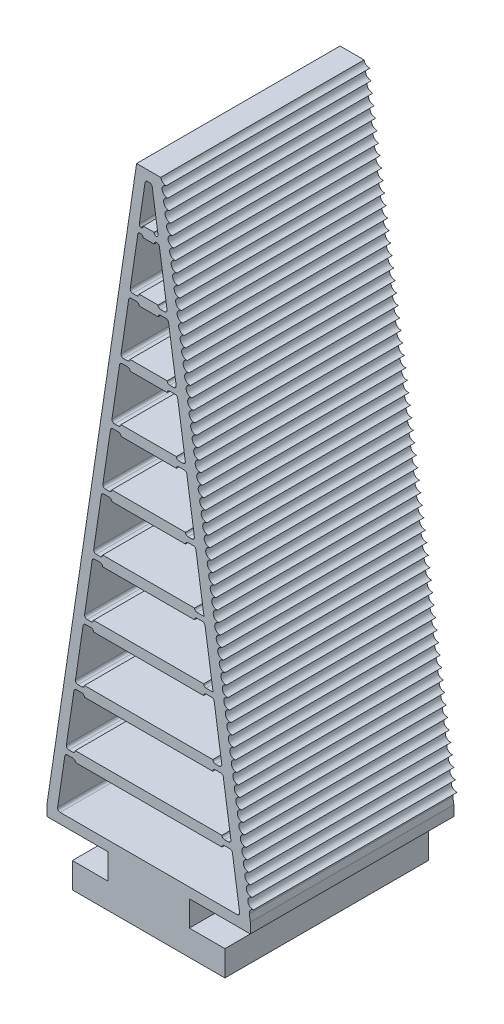
from build123d import *

# Parameters (mm, degrees)
BOSS_EXTRUDE1_DEPTH = 40
CUT_EXTRUDE1_DEPTH  = 138.477270849
CUT_EXTRUDE2_DEPTH  = 138.477270849
CUT_EXTRUDE3_DEPTH  = 138.477270849
CUT_EXTRUDE4_DEPTH  = 138.477270849
CUT_EXTRUDE5_DEPTH  = 138.477270849
CUT_EXTRUDE6_DEPTH  = 138.477270849
CUT_EXTRUDE7_DEPTH  = 138.477270849
CUT_EXTRUDE8_DEPTH  = 138.477270849
CUT_EXTRUDE9_DEPTH  = 138.477270849
CUT_EXTRUDE10_DEPTH = 138.477270849
FILLET1_R           = 0.5
BOSS_EXTRUDE2_DEPTH = 40
FILLET2_R           = 0.5


# Some blends are built 0.0001 mm under size
with BuildPart() as part:
    # Sketch1 → Boss-Extrude1 (new body)
    with BuildSketch(Plane.XY):
        Polygon((-15, 0), (15, 0), (15, 5), (8, 5), (8, 10), (20, 10), (20, 12), (2.364781841, 130), (-2.364781841, 130), (-20, 12), (-20, 10), (-8, 10), (-8, 5), (-15, 5), align=None)
    extrude(amount=BOSS_EXTRUDE1_DEPTH)

    # Sketch2 → Cut-Extrude1 (cut, through all)
    with BuildSketch(Plane.XY.offset(40)):
        Polygon((-17.977787744, 12), (17.977787744, 12), (16.40855223, 22.5), (14.40855223, 22.5), (14.40855223, 22), (-14.40855223, 22), (-14.40855223, 22.5), (-16.40855223, 22.5), align=None)
    extrude(amount=-CUT_EXTRUDE1_DEPTH, mode=Mode.SUBTRACT)

    # Sketch3 → Cut-Extrude2 (cut, through all)
    with BuildSketch(Plane.XY.offset(40)):
        Polygon((-16.259101229, 23.5), (-14.40855223, 23.5), (-14.40855223, 24), (14.40855223, 24), (14.40855223, 23.5), (16.259101229, 23.5), (14.615140214, 34.5), (12.615140214, 34.5), (12.615140214, 34), (-12.615140214, 34), (-12.615140214, 34.5), (-14.615140214, 34.5), align=None)
    extrude(amount=-CUT_EXTRUDE2_DEPTH, mode=Mode.SUBTRACT)

    # Sketch4 → Cut-Extrude3 (cut, through all)
    with BuildSketch(Plane.XY.offset(40)):
        Polygon((-14.465689213, 35.5), (-12.615140214, 35.5), (-12.615140214, 36), (12.615140214, 36), (12.615140214, 35.5), (14.465689213, 35.5), (12.821728198, 46.5), (10.821728198, 46.5), (10.821728198, 46), (-10.821728198, 46), (-10.821728198, 46.5), (-12.821728198, 46.5), align=None)
    extrude(amount=-CUT_EXTRUDE3_DEPTH, mode=Mode.SUBTRACT)

    # Sketch5 → Cut-Extrude4 (cut, through all)
    with BuildSketch(Plane.XY.offset(40)):
        Polygon((-12.672277196, 47.5), (-10.821728198, 47.5), (-10.821728198, 48), (10.821728198, 48), (10.821728198, 47.5), (12.672277196, 47.5), (11.028316182, 58.5), (9.028316182, 58.5), (9.028316182, 58), (-9.028316182, 58), (-9.028316182, 58.5), (-11.028316182, 58.5), align=None)
    extrude(amount=-CUT_EXTRUDE4_DEPTH, mode=Mode.SUBTRACT)

    # Sketch6 → Cut-Extrude5 (cut, through all)
    with BuildSketch(Plane.XY.offset(40)):
        Polygon((-10.87886518, 59.5), (-9.028316182, 59.5), (-9.028316182, 60), (9.028316182, 60), (9.028316182, 59.5), (10.87886518, 59.5), (9.234904165, 70.5), (7.234904165, 70.5), (7.234904165, 70), (-7.234904165, 70), (-7.234904165, 70.5), (-9.234904165, 70.5), align=None)
    extrude(amount=-CUT_EXTRUDE5_DEPTH, mode=Mode.SUBTRACT)

    # Sketch7 → Cut-Extrude6 (cut, through all)
    with BuildSketch(Plane.XY.offset(40)):
        Polygon((-9.085453164, 71.5), (-7.234904165, 71.5), (-7.234904165, 72), (7.234904165, 72), (7.234904165, 71.5), (9.085453164, 71.5), (7.441492149, 82.5), (5.441492149, 82.5), (5.441492149, 82), (-5.441492149, 82), (-5.441492149, 82.5), (-7.441492149, 82.5), align=None)
    extrude(amount=-CUT_EXTRUDE6_DEPTH, mode=Mode.SUBTRACT)

    # Sketch8 → Cut-Extrude7 (cut, through all)
    with BuildSketch(Plane.XY.offset(40)):
        Polygon((-7.292041148, 83.5), (-5.441492149, 83.5), (-5.441492149, 84), (5.441492149, 84), (5.441492149, 83.5), (7.292041148, 83.5), (5.648080133, 94.5), (3.648080133, 94.5), (3.648080133, 94), (-3.648080133, 94), (-3.648080133, 94.5), (-5.648080133, 94.5), align=None)
    extrude(amount=-CUT_EXTRUDE7_DEPTH, mode=Mode.SUBTRACT)

    # Sketch10 → Cut-Extrude8 (cut, through all)
    with BuildSketch(Plane.XY.offset(40)):
        Polygon((-5.498629132, 95.5), (-3.648080133, 95.5), (-3.648080133, 96), (3.648080133, 96), (3.648080133, 95.5), (5.498629132, 95.5), (3.854668117, 106.5), (1.854668117, 106.5), (1.854668117, 106), (-1.854668117, 106), (-1.854668117, 106.5), (-3.854668117, 106.5), align=None)
    extrude(amount=-CUT_EXTRUDE8_DEPTH, mode=Mode.SUBTRACT)

    # Sketch11 → Cut-Extrude9 (cut, through all)
    with BuildSketch(Plane.XY.offset(40)):
        Polygon((-3.705217115, 107.5), (-1.854668117, 107.5), (-1.854668117, 108), (1.854668117, 108), (1.854668117, 107.5), (3.705217115, 107.5), (2.061256101, 118.5), (1.061256101, 118.5), (1.061256101, 118), (-1.061256101, 118), (-1.061256101, 118.5), (-2.061256101, 118.5), align=None)
    extrude(amount=-CUT_EXTRUDE9_DEPTH, mode=Mode.SUBTRACT)

    # Sketch12 → Cut-Extrude10 (cut, through all)
    with BuildSketch(Plane.XY.offset(40)):
        Polygon((-1.911805099, 119.5), (-1.061256101, 119.5), (-1.061256101, 120), (1.061256101, 120), (1.061256101, 119.5), (1.911805099, 119.5), (0.641471588, 128), (-0.641471588, 128), align=None)
    extrude(amount=-CUT_EXTRUDE10_DEPTH, mode=Mode.SUBTRACT)

    # Fillet1
    fillet1_edges = [part.edges().sort_by_distance(p)[0] for p in [
        (-1.061256101, 119.5, 20),
        (-1.854668117, 107.5, 20),
        (-1.061256101, 118.5, 20),
        (-1.854668117, 106.5, 20),
        (1.061256101, 119.5, 20),
        (1.061256101, 118.5, 20),
        (1.854668117, 106.5, 20),
        (3.648080133, 94.5, 20),
        (-3.648080133, 94.5, 20),
        (-5.441492149, 82.5, 20),
        (-3.648080133, 95.5, 20),
        (-5.441492149, 83.5, 20),
        (-7.234904165, 71.5, 20),
        (-9.028316182, 59.5, 20),
        (1.854668117, 107.5, 20),
        (3.648080133, 95.5, 20),
        (5.441492149, 83.5, 20),
        (7.234904165, 71.5, 20),
        (9.028316182, 59.5, 20),
        (10.821728198, 47.5, 20),
        (5.441492149, 82.5, 20),
        (7.234904165, 70.5, 20),
        (9.028316182, 58.5, 20),
        (10.821728198, 46.5, 20),
        (-7.234904165, 70.5, 20),
        (-9.028316182, 58.5, 20),
        (-10.821728198, 46.5, 20),
        (-10.821728198, 47.5, 20),
        (-12.615140214, 35.5, 20),
        (12.615140214, 35.5, 20),
        (12.615140214, 34.5, 20),
        (-12.615140214, 34.5, 20),
        (-14.40855223, 22.5, 20),
        (-14.40855223, 23.5, 20),
        (14.40855223, 22.5, 20),
        (14.40855223, 23.5, 20),
    ]]
    fillet(fillet1_edges, radius=FILLET1_R - 0.0001)  # a hair under: the kernel refuses the full size

    # Sketch13 → Boss-Extrude2 (add)
    with BuildSketch(Plane.XY.offset(40)):
        with BuildLine():
            Line((2.364781841, 130), (0.342569585, 130))
            Line((0.342569585, 130), (17.828260627, 13.000509301))
            Line((17.828260627, 13.000509301), (19.806292354, 13.296128123))
            ThreePointArc((19.806292354, 13.296128123), (19.991451357, 14.038760321), (20.647498806, 14.432953398))
            ThreePointArc((20.647498806, 14.432953398), (19.510673532, 15.27415985), (20.351879984, 16.410985125))
            ThreePointArc((20.351879984, 16.410985125), (19.21505471, 17.252191577), (20.056261162, 18.389016851))
            ThreePointArc((20.056261162, 18.389016851), (18.919435887, 19.230223303), (19.76064234, 20.367048578))
            ThreePointArc((19.76064234, 20.367048578), (18.623817065, 21.20825503), (19.465023517, 22.345080305))
            ThreePointArc((19.465023517, 22.345080305), (18.328198243, 23.186286757), (19.169404695, 24.323112031))
            ThreePointArc((19.169404695, 24.323112031), (18.032579421, 25.164318484), (18.873785873, 26.301143758))
            ThreePointArc((18.873785873, 26.301143758), (17.736960598, 27.14235021), (18.578167051, 28.279175485))
            ThreePointArc((18.578167051, 28.279175485), (17.441341776, 29.120381937), (18.282548228, 30.257207212))
            ThreePointArc((18.282548228, 30.257207212), (17.145722954, 31.098413664), (17.986929406, 32.235238938))
            ThreePointArc((17.986929406, 32.235238938), (16.850104132, 33.076445391), (17.691310584, 34.213270665))
            ThreePointArc((17.691310584, 34.213270665), (16.554485309, 35.054477117), (17.395691761, 36.191302392))
            ThreePointArc((17.395691761, 36.191302392), (16.258866487, 37.032508844), (17.100072939, 38.169334118))
            ThreePointArc((17.100072939, 38.169334118), (15.963247665, 39.010540571), (16.804454117, 40.147365845))
            ThreePointArc((16.804454117, 40.147365845), (15.667628842, 40.988572297), (16.508835295, 42.125397572))
            ThreePointArc((16.508835295, 42.125397572), (15.37201002, 42.966604024), (16.213216472, 44.103429299))
            ThreePointArc((16.213216472, 44.103429299), (15.076391198, 44.944635751), (15.91759765, 46.081461025))
            ThreePointArc((15.91759765, 46.081461025), (14.780772376, 46.922667478), (15.621978828, 48.059492752))
            ThreePointArc((15.621978828, 48.059492752), (14.485153553, 48.900699204), (15.326360006, 50.037524479))
            ThreePointArc((15.326360006, 50.037524479), (14.189534731, 50.878730931), (15.030741183, 52.015556206))
            ThreePointArc((15.030741183, 52.015556206), (13.893915909, 52.856762658), (14.735122361, 53.993587932))
            ThreePointArc((14.735122361, 53.993587932), (13.598297087, 54.834794384), (14.439503539, 55.971619659))
            ThreePointArc((14.439503539, 55.971619659), (13.302678264, 56.812826111), (14.143884717, 57.949651386))
            ThreePointArc((14.143884717, 57.949651386), (13.007059442, 58.790857838), (13.848265894, 59.927683112))
            ThreePointArc((13.848265894, 59.927683112), (12.71144062, 60.768889565), (13.552647072, 61.905714839))
            ThreePointArc((13.552647072, 61.905714839), (12.415821798, 62.746921291), (13.25702825, 63.883746566))
            ThreePointArc((13.25702825, 63.883746566), (12.120202975, 64.724953018), (12.961409428, 65.861778293))
            ThreePointArc((12.961409428, 65.861778293), (11.824584153, 66.702984745), (12.665790605, 67.839810019))
            ThreePointArc((12.665790605, 67.839810019), (11.528965331, 68.681016472), (12.370171783, 69.817841746))
            ThreePointArc((12.370171783, 69.817841746), (11.233346509, 70.659048198), (12.074552961, 71.795873473))
            ThreePointArc((12.074552961, 71.795873473), (10.937727686, 72.637079925), (11.778934139, 73.7739052))
            ThreePointArc((11.778934139, 73.7739052), (10.642108864, 74.615111652), (11.483315316, 75.751936926))
            ThreePointArc((11.483315316, 75.751936926), (10.346490042, 76.593143378), (11.187696494, 77.729968653))
            ThreePointArc((11.187696494, 77.729968653), (10.05087122, 78.571175105), (10.892077672, 79.70800038))
            ThreePointArc((10.892077672, 79.70800038), (9.755252397, 80.549206832), (10.59645885, 81.686032106))
            ThreePointArc((10.59645885, 81.686032106), (9.459633575, 82.527238559), (10.300840027, 83.664063833))
            ThreePointArc((10.300840027, 83.664063833), (9.164014753, 84.505270285), (10.005221205, 85.64209556))
            ThreePointArc((10.005221205, 85.64209556), (8.868395931, 86.483302012), (9.709602383, 87.620127287))
            ThreePointArc((9.709602383, 87.620127287), (8.572777108, 88.461333739), (9.41398356, 89.598159013))
            ThreePointArc((9.41398356, 89.598159013), (8.277158286, 90.439365466), (9.118364738, 91.57619074))
            ThreePointArc((9.118364738, 91.57619074), (7.981539464, 92.417397192), (8.822745916, 93.554222467))
            ThreePointArc((8.822745916, 93.554222467), (7.685920641, 94.395428919), (8.527127094, 95.532254193))
            ThreePointArc((8.527127094, 95.532254193), (7.390301819, 96.373460646), (8.231508271, 97.51028592))
            ThreePointArc((8.231508271, 97.51028592), (7.094682997, 98.351492372), (7.935889449, 99.488317647))
            ThreePointArc((7.935889449, 99.488317647), (6.799064175, 100.329524099), (7.640270627, 101.466349374))
            ThreePointArc((7.640270627, 101.466349374), (6.503445352, 102.307555826), (7.344651805, 103.4443811))
            ThreePointArc((7.344651805, 103.4443811), (6.20782653, 104.285587553), (7.049032982, 105.422412827))
            ThreePointArc((7.049032982, 105.422412827), (5.912207708, 106.263619279), (6.75341416, 107.400444554))
            ThreePointArc((6.75341416, 107.400444554), (5.616588886, 108.241651006), (6.457795338, 109.378476281))
            ThreePointArc((6.457795338, 109.378476281), (5.320970063, 110.219682733), (6.162176516, 111.356508007))
            ThreePointArc((6.162176516, 111.356508007), (5.025351241, 112.197714459), (5.866557693, 113.334539734))
            ThreePointArc((5.866557693, 113.334539734), (4.729732419, 114.175746186), (5.570938871, 115.312571461))
            ThreePointArc((5.570938871, 115.312571461), (4.434113597, 116.153777913), (5.275320049, 117.290603187))
            ThreePointArc((5.275320049, 117.290603187), (4.138494774, 118.13180964), (4.979701227, 119.268634914))
            ThreePointArc((4.979701227, 119.268634914), (3.842875952, 120.109841366), (4.684082404, 121.246666641))
            ThreePointArc((4.684082404, 121.246666641), (3.54725713, 122.087873093), (4.388463582, 123.224698368))
            ThreePointArc((4.388463582, 123.224698368), (3.251638308, 124.06590482), (4.09284476, 125.202730094))
            ThreePointArc((4.09284476, 125.202730094), (2.956019485, 126.043936547), (3.797225938, 127.180761821))
            ThreePointArc((3.797225938, 127.180761821), (2.660400663, 128.021968273), (3.501607115, 129.158793548))
            ThreePointArc((3.501607115, 129.158793548), (2.758974917, 129.343952551), (2.364781841, 130))
        make_face()
    extrude(amount=-BOSS_EXTRUDE2_DEPTH)

    # Fillet2
    # the kernel refuses this fillet: 0.5 mm, written as the material it adds along each edge
    with BuildSketch(Plane(origin=(17.977787744, 12, 40), x_dir=(-1, 0, 0), z_dir=(0, 0, -1)), Plane(origin=(-17.977787744, 12, 40), x_dir=(0.14780941112960694, 0.9890158633619174, 0), z_dir=(0, 0, -1)), Plane(origin=(-3.705217115, 107.5, 40), x_dir=(0.14780941112960738, 0.9890158633619174, 0), z_dir=(0, 0, -1)), Plane(origin=(3.705217115, 107.5, 40), x_dir=(-1, 0, 0), z_dir=(0, 0, -1)), Plane(origin=(5.498629132, 95.5, 40), x_dir=(-1, 0, 0), z_dir=(0, 0, -1)), Plane(origin=(-5.498629132, 95.5, 40), x_dir=(0.14780941112960647, 0.9890158633619175, 0), z_dir=(0, 0, -1)), Plane(origin=(7.292041148, 83.5, 40), x_dir=(-1, 0, 0), z_dir=(0, 0, -1)), Plane(origin=(9.085453164, 71.5, 40), x_dir=(-1, 0, 0), z_dir=(0, 0, -1)), Plane(origin=(-7.292041148, 83.5, 40), x_dir=(0.14780941112960588, 0.9890158633619176, 0), z_dir=(0, 0, -1)), Plane(origin=(-9.085453164, 71.5, 40), x_dir=(0.14780941112960796, 0.9890158633619173, 0), z_dir=(0, 0, -1)), Plane(origin=(-10.87886518, 59.5, 40), x_dir=(0.14780941112960858, 0.9890158633619172, 0), z_dir=(0, 0, -1)), Plane(origin=(-12.672277196, 47.5, 40), x_dir=(0.14780941112960738, 0.9890158633619174, 0), z_dir=(0, 0, -1)), Plane(origin=(14.465689213, 35.5, 40), x_dir=(-1, 0, 0), z_dir=(0, 0, -1)), Plane(origin=(-14.465689213, 35.5, 40), x_dir=(0.14780941112960858, 0.9890158633619172, 0), z_dir=(0, 0, -1)), Plane(origin=(-16.259101229, 23.5, 40), x_dir=(0.1478094111296065, 0.9890158633619175, 0), z_dir=(0, 0, -1)), Plane(origin=(16.259101229, 23.5, 40), x_dir=(-1, 0, 0), z_dir=(0, 0, -1))) as fillet2_piece_1:
        with BuildLine():
            CenterArc((FILLET2_R * 1.16055712921, FILLET2_R), FILLET2_R, 171.5, 98.5)
            Line((FILLET2_R * 0.171541265851, FILLET2_R * 1.14780941113), (FILLET2_R * 0.151760948584, FILLET2_R * 1.15076559935))
            Line((FILLET2_R * 0.151760948584, FILLET2_R * 1.15076559935), (-FILLET2_R * 0.0232111425843, -FILLET2_R * 0.02))
            Line((-FILLET2_R * 0.0232111425843, -FILLET2_R * 0.02), (FILLET2_R * 1.16055712921, -FILLET2_R * 0.02))
            Line((FILLET2_R * 1.16055712921, -FILLET2_R * 0.02), (FILLET2_R * 1.16055712921, 0))
        make_face()
    extrude(amount=40)
    with BuildSketch(Plane(origin=(0.641471588, 128, 40), x_dir=(0.1478094111296105, -0.9890158633619168, 0), z_dir=(0, 0, -1)), Plane(origin=(-2.061256101, 118.5, 40), x_dir=(1, 0, 0), z_dir=(0, 0, -1)), Plane(origin=(2.061256101, 118.5, 40), x_dir=(0.14780941112960821, -0.9890158633619172, 0), z_dir=(0, 0, -1)), Plane(origin=(-3.854668117, 106.5, 40), x_dir=(1, 0, 0), z_dir=(0, 0, -1)), Plane(origin=(3.854668117, 106.5, 40), x_dir=(0.14780941112960744, -0.9890158633619173, 0), z_dir=(0, 0, -1)), Plane(origin=(-5.648080133, 94.5, 40), x_dir=(1, 0, 0), z_dir=(0, 0, -1)), Plane(origin=(5.648080133, 94.5, 40), x_dir=(0.14780941112960924, -0.989015863361917, 0), z_dir=(0, 0, -1)), Plane(origin=(7.441492149, 82.5, 40), x_dir=(0.147809411129608, -0.9890158633619172, 0), z_dir=(0, 0, -1)), Plane(origin=(-7.441492149, 82.5, 40), x_dir=(1, 0, 0), z_dir=(0, 0, -1)), Plane(origin=(-9.234904165, 70.5, 40), x_dir=(1, 0, 0), z_dir=(0, 0, -1)), Plane(origin=(-11.028316182, 58.5, 40), x_dir=(1, 0, 0), z_dir=(0, 0, -1)), Plane(origin=(9.234904165, 70.5, 40), x_dir=(0.14780941112960722, -0.9890158633619173, 0), z_dir=(0, 0, -1)), Plane(origin=(11.028316182, 58.5, 40), x_dir=(0.1478094111296048, -0.9890158633619176, 0), z_dir=(0, 0, -1)), Plane(origin=(12.821728198, 46.5, 40), x_dir=(0.1478094111296056, -0.9890158633619176, 0), z_dir=(0, 0, -1)), Plane(origin=(14.615140214, 34.5, 40), x_dir=(0.14780941112960963, -0.989015863361917, 0), z_dir=(0, 0, -1)), Plane(origin=(-12.821728198, 46.5, 40), x_dir=(1, 0, 0), z_dir=(0, 0, -1)), Plane(origin=(-14.615140214, 34.5, 40), x_dir=(1, 0, 0), z_dir=(0, 0, -1)), Plane(origin=(-16.40855223, 22.5, 40), x_dir=(1, 0, 0), z_dir=(0, 0, -1)), Plane(origin=(16.40855223, 22.5, 40), x_dir=(0.14780941112960844, -0.9890158633619173, 0), z_dir=(0, 0, -1))) as fillet2_piece_2:
        with BuildLine():
            CenterArc((FILLET2_R * 0.861655126515, FILLET2_R), FILLET2_R, 188.5, 81.5)
            Line((-FILLET2_R * 0.127360736847, FILLET2_R * 0.85219058887), (-FILLET2_R * 0.147141054114, FILLET2_R * 0.849234400648))
            Line((-FILLET2_R * 0.147141054114, FILLET2_R * 0.849234400648), (-FILLET2_R * 0.0172331025303, -FILLET2_R * 0.02))
            Line((-FILLET2_R * 0.0172331025303, -FILLET2_R * 0.02), (FILLET2_R * 0.861655126515, -FILLET2_R * 0.02))
            Line((FILLET2_R * 0.861655126515, -FILLET2_R * 0.02), (FILLET2_R * 0.861655126515, 0))
        make_face()
    extrude(amount=40)
    with BuildSketch(Plane(origin=(-0.641471588, 128, 40), x_dir=(-0.14780941112960694, -0.9890158633619174, 0), z_dir=(0, 0, -1))) as fillet2_piece_3:
        with BuildLine():
            CenterArc((FILLET2_R * 0.861655126515, -FILLET2_R), FILLET2_R, 90, 81.5)
            Line((-FILLET2_R * 0.127360736847, -FILLET2_R * 0.85219058887), (-FILLET2_R * 0.147141054114, -FILLET2_R * 0.849234400648))
            Line((-FILLET2_R * 0.147141054114, -FILLET2_R * 0.849234400648), (-FILLET2_R * 0.0172331025303, FILLET2_R * 0.02))
            Line((-FILLET2_R * 0.0172331025303, FILLET2_R * 0.02), (FILLET2_R * 0.861655126515, FILLET2_R * 0.02))
            Line((FILLET2_R * 0.861655126515, FILLET2_R * 0.02), (FILLET2_R * 0.861655126515, 0))
        make_face()
    extrude(amount=40)
    with BuildSketch(Plane(origin=(1.911805099, 119.5, 40), x_dir=(-1, 0, 0), z_dir=(0, 0, -1))) as fillet2_piece_4:
        with BuildLine():
            CenterArc((0.572518756, 0.448077907), FILLET2_R, 171.5, 72.157278574)
            Line((0.078010824, 0.521982613), (0.068120666, 0.523460707))
            Line((0.068120666, 0.523460707), (-0.009890159, 0.001478094))
            Line((-0.009890159, 0.001478094), (0, -0.01))
            ThreePointArc((0, -0.01), (0.175324499, -0.01), (0.346211604, -0.008961558))
            Line((0.346211604, -0.008961558), (0.350648999, 0))
        make_face()
    extrude(amount=40)
    with BuildSketch(Plane(origin=(-1.911805099, 119.5, 40), x_dir=(0.1478094111296077, 0.9890158633619173, 0), z_dir=(0, 0, -1))) as fillet2_piece_5:
        with BuildLine():
            CenterArc((0.527779818, 0.5), FILLET2_R, 197.842721426, 72.157278574)
            Line((0.051829222, 0.346797422), (0.04231021, 0.343733371))
            ThreePointArc((0.04231021, 0.343733371), (0.016024452, 0.174876805), (-0.009890159, 0.001478094))
            Line((-0.009890159, 0.001478094), (0, -0.01))
            Line((0, -0.01), (0.527779818, -0.01))
            Line((0.527779818, -0.01), (0.527779818, 0))
        make_face()
    extrude(amount=40)


solid = part.part
